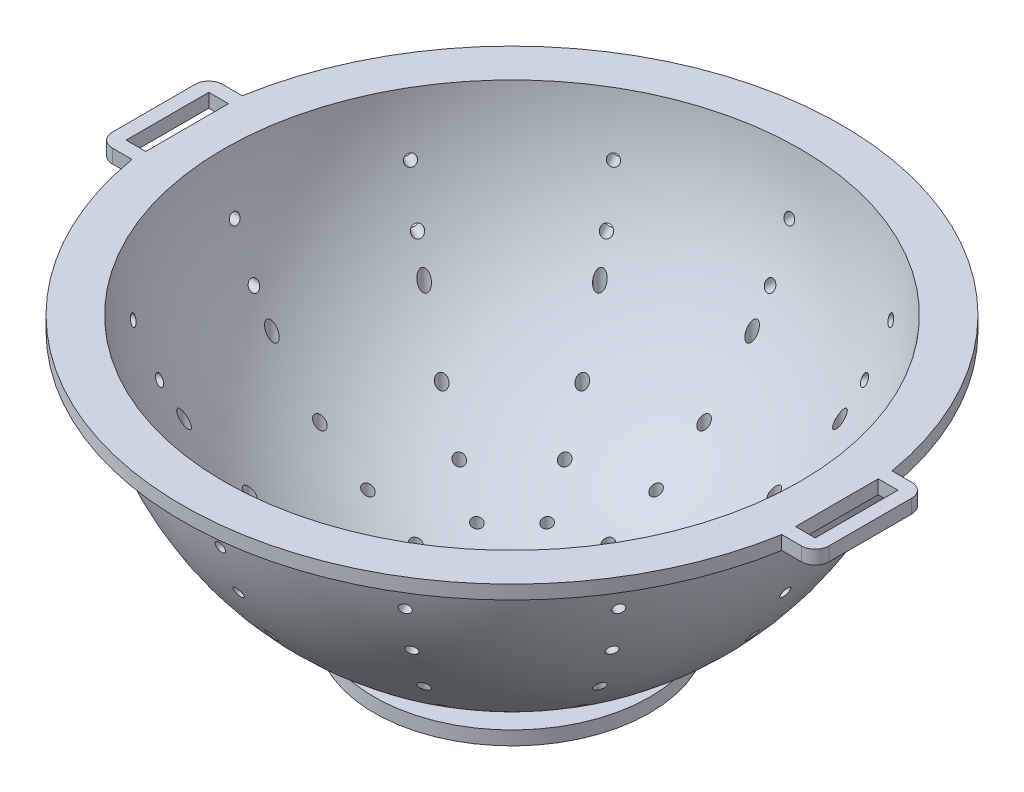
from build123d import *

# Parameters (mm, degrees)
BOSS_EXTRUDE1_START     = -6.35
BOSS_EXTRUDE1_DEPTH     = 6.35
SKETCH3_R               = 2.38125
SKETCH3_W               = 9.068281504
SKETCH3_H               = 38.1
CUT_EXTRUDE2_DEPTH      = 258.753344987
CUT_EXTRUDE3_REACH      = 386.982
CUT_EXTRUDE3_END_RADIUS = 133.35
SKETCH4_R               = 2.38125
CIRPATTERN1_COUNT       = 12


with BuildPart() as part:
    # Sketch1 → Revolve1 (revolve)
    with BuildSketch(Plane.XY):
        with BuildLine():
            ThreePointArc((-138.395041457, 120.65), (-138.794605186, 123.820844756), (-139.121529606, 127))
            Line((-139.121529606, 127), (-151.821529606, 127))
            Line((-151.821529606, 127), (-151.821529606, 120.65))
            Line((-151.821529606, 120.65), (-138.395041457, 120.65))
        make_face()
        with BuildLine():
            Line((-138.395041457, 127), (-139.121529606, 127))
            ThreePointArc((-139.121529606, 127), (-138.794605186, 123.820844756), (-138.395041457, 120.65))
            Line((-138.395041457, 120.65), (-138.395041457, 127))
        make_face()
        with BuildLine():
            Line((-132.743860498, 127), (-138.395041457, 127))
            Line((-138.395041457, 127), (-138.395041457, 120.65))
            ThreePointArc((-138.395041457, 120.65), (-106.626697643, 49.440167572), (-41.639734629, 6.35))
            Line((-41.639734629, 6.35), (0, 6.35))
            ThreePointArc((0, 6.35), (-89.690237763, 41.019283799), (-132.743860498, 127))
        make_face()
        with BuildLine():
            ThreePointArc((0, 0), (-21.060567419, 1.596623865), (-41.639734629, 6.35))
            Line((-41.639734629, 6.35), (-63.5, 6.35))
            Line((-63.5, 6.35), (-63.5, 0))
            Line((-63.5, 0), (0, 0))
        make_face()
        with BuildLine():
            Line((0, 6.35), (-41.639734629, 6.35))
            ThreePointArc((-41.639734629, 6.35), (-21.060567419, 1.596623865), (0, 0))
            Line((0, 0), (0, 6.35))
        make_face()
    revolve(axis=Axis((0, 0, 0), (0, 1, 0)))

    # Sketch2 → Boss-Extrude1 (add)
    with BuildSketch(Plane(origin=(0, 127, 0), x_dir=(1, 0, 0), z_dir=(0, 1, 0)).offset(BOSS_EXTRUDE1_START)):
        with BuildLine():
            Line((149.681718496, -25.4), (158.75, -25.4))
            ThreePointArc((158.75, -25.4), (163.240128061, -23.540128061), (165.1, -19.05))
            Line((165.1, -19.05), (165.1, 19.05))
            ThreePointArc((165.1, 19.05), (163.240128061, 23.540128061), (158.75, 25.4))
            Line((158.75, 25.4), (149.681718496, 25.4))
            ThreePointArc((149.681718496, 25.4), (151.285631023, 12.744987167), (151.821529606, 0))
            ThreePointArc((151.821529606, 0), (151.285631023, -12.744987167), (149.681718496, -25.4))
        make_face()
        with BuildLine():
            Line((-158.75, -25.4), (-149.681718496, -25.4))
            ThreePointArc((-149.681718496, -25.4), (-151.821529606, 0), (-149.681718496, 25.4))
            Line((-149.681718496, 25.4), (-158.75, 25.4))
            ThreePointArc((-158.75, 25.4), (-163.240128061, 23.540128061), (-165.1, 19.05))
            Line((-165.1, 19.05), (-165.1, -19.05))
            ThreePointArc((-165.1, -19.05), (-163.240128061, -23.540128061), (-158.75, -25.4))
        make_face()
    extrude(amount=BOSS_EXTRUDE1_DEPTH)

    # Sketch3 → Cut-Extrude2 (cut, through all)
    with BuildSketch(Plane(origin=(0, 127, 0), x_dir=(1, 0, 0), z_dir=(0, 1, 0))):
        with Locations(Location((-95.79962949, 55.309941874, 0), (0, 0, 19.346212496))):
            Circle(SKETCH3_R)
        with Locations(Location((-76.639703592, 44.247953499, 0), (0, 0, 254.783404341))):
            Circle(SKETCH3_R)
        with Locations(Location((-57.479777694, 33.185965125, 0), (0, 0, 145.229790873))):
            Circle(SKETCH3_R)
        with Locations(Location((-38.319851796, 22.12397675, 0), (0, 0, 145.907806107))):
            Circle(SKETCH3_R)
        with Locations(Location((-19.159925898, 11.061988375, 0), (0, 0, 180))):
            Circle(SKETCH3_R)
        with Locations(Location((-55.309941874, 95.79962949, 0), (0, 0, 246.345324798))):
            Circle(SKETCH3_R)
        with Locations(Location((-44.247953499, 76.639703592, 0), (0, 0, 216.899136125))):
            Circle(SKETCH3_R)
        with Locations(Location((-33.185965125, 57.479777694, 0), (0, 0, 152.367800756))):
            Circle(SKETCH3_R)
        with Locations(Location((-22.12397675, 38.319851796, 0), (0, 0, 148.723600293))):
            Circle(SKETCH3_R)
        with Locations(Location((-11.061988375, 19.159925898, 0), (0, 0, 180))):
            Circle(SKETCH3_R)
        with Locations(Location((0, 110.619883749, 0), (0, 0, 229.450220734))):
            Circle(SKETCH3_R)
        with Locations(Location((0, 88.495906999, 0), (0, 0, 176.941212156))):
            Circle(SKETCH3_R)
        with Locations(Location((0, 66.371930249, 0), (0, 0, 171.690465937))):
            Circle(SKETCH3_R)
        with Locations(Location((0, 44.247953499, 0), (0, 0, 203.441492097))):
            Circle(SKETCH3_R)
        with Locations(Location((0, 22.12397675, 0), (0, 0, 180))):
            Circle(SKETCH3_R)
        with Locations(Location((55.309941874, 95.79962949, 0), (0, 0, 235.315529624))):
            Circle(SKETCH3_R)
        with Locations(Location((44.247953499, 76.639703592, 0), (0, 0, 170.566172569))):
            Circle(SKETCH3_R)
        with Locations(Location((33.185965125, 57.479777694, 0), (0, 0, 153.436432388))):
            Circle(SKETCH3_R)
        with Locations(Location((22.12397675, 38.319851796, 0), (0, 0, 143.787070733))):
            Circle(SKETCH3_R)
        with Locations(Location((11.061988375, 19.159925898, 0), (0, 0, 180))):
            Circle(SKETCH3_R)
        with Locations(Location((95.79962949, 55.309941874, 0), (0, 0, 168.13304844))):
            Circle(SKETCH3_R)
        with Locations(Location((76.639703592, 44.247953499, 0), (0, 0, 165.564333874))):
            Circle(SKETCH3_R)
        with Locations(Location((57.479777694, 33.185965125, 0), (0, 0, 156.985390871))):
            Circle(SKETCH3_R)
        with Locations(Location((38.319851796, 22.12397675, 0), (0, 0, 150.47718314))):
            Circle(SKETCH3_R)
        with Locations(Location((19.159925898, 11.061988375, 0), (0, 0, 180))):
            Circle(SKETCH3_R)
        with Locations(Location((110.619883749, 0, 0), (0, 0, 179.999997781))):
            Circle(SKETCH3_R)
        with Locations(Location((88.495906999, 0, 0), (0, 0, 180.000000532))):
            Circle(SKETCH3_R)
        with Locations(Location((66.371930249, 0, 0), (0, 0, 180.000000106))):
            Circle(SKETCH3_R)
        with Locations(Location((44.247953499, 0, 0), (0, 0, 180.000000394))):
            Circle(SKETCH3_R)
        with Locations(Location((22.12397675, 0, 0), (0, 0, 180))):
            Circle(SKETCH3_R)
        with Locations(Location((95.79962949, -55.309941874, 0), (0, 0, 150.275045601))):
            Circle(SKETCH3_R)
        with Locations(Location((76.639703592, -44.247953499, 0), (0, 0, 147.591766403))):
            Circle(SKETCH3_R)
        with Locations(Location((57.479777694, -33.185965125, 0), (0, 0, 147.256312762))):
            Circle(SKETCH3_R)
        with Locations(Location((38.319851796, -22.12397675, 0), (0, 0, 146.388581376))):
            Circle(SKETCH3_R)
        with Locations(Location((19.159925898, -11.061988375, 0), (0, 0, 180))):
            Circle(SKETCH3_R)
        with Locations(Location((55.309941874, -95.79962949, 0), (0, 0, 124.684470376))):
            Circle(SKETCH3_R)
        with Locations(Location((44.247953499, -76.639703592, 0), (0, 0, 132.416551551))):
            Circle(SKETCH3_R)
        with Locations(Location((33.185965125, -57.479777694, 0), (0, 0, 143.631378893))):
            Circle(SKETCH3_R)
        with Locations(Location((22.12397675, -38.319851796, 0), (0, 0, 148.920004688))):
            Circle(SKETCH3_R)
        with Locations(Location((11.061988375, -19.159925898, 0), (0, 0, 180))):
            Circle(SKETCH3_R)
        with Locations(Location((0, -110.619883749, 0), (0, 0, 130.549779266))):
            Circle(SKETCH3_R)
        with Locations(Location((0, -88.495906999, 0), (0, 0, 137.055557043))):
            Circle(SKETCH3_R)
        with Locations(Location((-22.12397675, 0, 0), (0, 0, 180))):
            Circle(SKETCH3_R)
        with Locations(Location((-44.247953499, 0, 0), (0, 0, 180.000000229))):
            Circle(SKETCH3_R)
        with Locations(Location((-66.371930249, 0, 0), (0, 0, 179.999999823))):
            Circle(SKETCH3_R)
        with Locations(Location((-88.495906999, 0, 0), (0, 0, 180))):
            Circle(SKETCH3_R)
        with Locations(Location((-110.619883749, 0, 0), (0, 0, 179.999997743))):
            Circle(SKETCH3_R)
        with Locations(Location((0, -66.371930249, 0), (0, 0, 137.24248491))):
            Circle(SKETCH3_R)
        with Locations(Location((0, -44.247953499, 0), (0, 0, 138.177782218))):
            Circle(SKETCH3_R)
        with Locations(Location((0, -22.12397675, 0), (0, 0, 180))):
            Circle(SKETCH3_R)
        with Locations(Location((-55.309941874, -95.79962949, 0), (0, 0, 113.654675202))):
            Circle(SKETCH3_R)
        with Locations(Location((-44.247953499, -76.639703592, 0), (0, 0, 127.125901637))):
            Circle(SKETCH3_R)
        with Locations(Location((-33.185965125, -57.479777694, 0), (0, 0, 140.911583803))):
            Circle(SKETCH3_R)
        with Locations(Location((-22.12397675, -38.319851796, 0), (0, 0, 136.64686513))):
            Circle(SKETCH3_R)
        with Locations(Location((-11.061988375, -19.159925898, 0), (0, 0, 180))):
            Circle(SKETCH3_R)
        with Locations(Location((-95.79962949, -55.309941874, 0), (0, 0, 31.195654344))):
            Circle(SKETCH3_R)
        with Locations(Location((-76.639703592, -44.247953499, 0), (0, 0, 128.126655276))):
            Circle(SKETCH3_R)
        with Locations(Location((-57.479777694, -33.185965125, 0), (0, 0, 142.263642311))):
            Circle(SKETCH3_R)
        with Locations(Location((-38.319851796, -22.12397675, 0), (0, 0, 144.167585386))):
            Circle(SKETCH3_R)
        with Locations(Location((-19.159925898, -11.061988375, 0), (0, 0, 180))):
            Circle(SKETCH3_R)
        with Locations((-154.215859248, 0)):
            Rectangle(SKETCH3_W, SKETCH3_H)
        with Locations((154.215859248, 0)):
            Rectangle(SKETCH3_W, SKETCH3_H)
    extrude(amount=-CUT_EXTRUDE2_DEPTH, mode=Mode.SUBTRACT)

    # Cut-Extrude3: up to this sphere (the profile starts outside it)
    cut_extrude3_end = Location((0, 139.7, 0)) * Sphere(CUT_EXTRUDE3_END_RADIUS, mode=Mode.PRIVATE)
    # Sketch4 → Cut-Extrude3 (cut, up to the surface)
    with BuildSketch(Plane(origin=(165.1, 0, 0), x_dir=(0, 0, -1), z_dir=(1, 0, 0)), mode=Mode.PRIVATE) as cut_extrude3_sk1:
        with Locations(Location((0, 79.375, 0), (0, 0, 90))):
            Circle(SKETCH4_R)
    cut_extrude3_tool1 = extrude(cut_extrude3_sk1.sketch, amount=-CUT_EXTRUDE3_REACH, mode=Mode.PRIVATE) - cut_extrude3_end
    # Sketch4 → Cut-Extrude3 (cut, up to the surface)
    with BuildSketch(Plane(origin=(165.1, 0, 0), x_dir=(0, 0, -1), z_dir=(1, 0, 0)), mode=Mode.PRIVATE) as cut_extrude3_sk2:
        with Locations(Location((0, 101.6, 0), (0, 0, 90.000000105))):
            Circle(SKETCH4_R)
    cut_extrude3_tool2 = extrude(cut_extrude3_sk2.sketch, amount=-CUT_EXTRUDE3_REACH, mode=Mode.PRIVATE) - cut_extrude3_end
    cut_extrude3 = cut_extrude3_tool1.solids().sort_by_distance((165.1, 79.375, 0))[0] + cut_extrude3_tool2.solids().sort_by_distance((165.1, 101.6, 0))[0]
    add(cut_extrude3, mode=Mode.SUBTRACT)

    # CirPattern1: Cut-Extrude3 ×12 about axis
    cirpattern1_axis = Axis((0, 0, 0), (0, -1, 0))
    for i in range(1, CIRPATTERN1_COUNT):
        add(cut_extrude3.rotate(cirpattern1_axis, i * 360 / CIRPATTERN1_COUNT), mode=Mode.SUBTRACT)


solid = part.part
